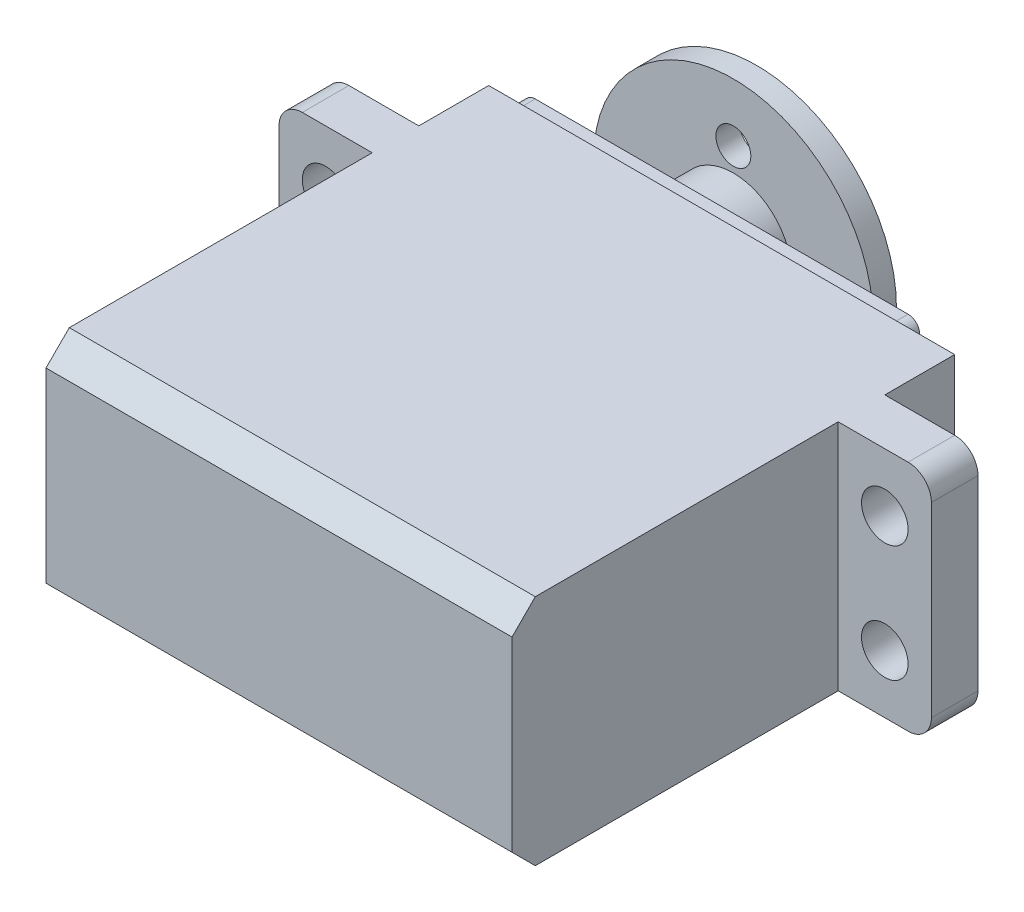
from build123d import *

# Parameters (mm, degrees)
SKETCH_1_W             = 40
SKETCH_1_H             = 40
EXTRUDE_1_DEPTH        = 20
CHAMFER_1_SIZE         = 2
CHAMFER_2_SIZE         = 2
SKETCH_2_W             = 40
SKETCH_2_H             = 20
SKETCH_2_W_2           = 34
SKETCH_2_H_2           = 18
CUT_EXTRUDE_1_DEPTH    = 2
FILLET_1_R             = 1
FILLET_2_R             = 1
FILLET_3_R             = 1
FILLET_4_R             = 1
SKETCH_3_R             = 5
EXTRUDE_2_DEPTH        = 7
SKETCH_4_R             = 12
EXTRUDE_3_DEPTH        = 2
CUT_EXTRUDE_2_REACH    = 59.315
SKETCH_5_R             = 1.5
SKETCH_6_W             = 4
SKETCH_6_H             = 20
EXTRUDE_4_DEPTH        = 8
CUT_EXTRUDE_3_REACH    = 49.875
SKETCH_7_R             = 2
FILLET_5_R             = 2
FILLET_6_R             = 2
FILLET_5_OF_MIRROR_1_R = 2
FILLET_6_OF_MIRROR_1_R = 2


with BuildPart() as part:
    # 草图1 → 凸台-拉伸1 (new body)
    with BuildSketch(Plane(origin=(0, 0, 0), x_dir=(1, 0, 0), z_dir=(0, 1, 0))):
        Rectangle(SKETCH_1_W, SKETCH_1_H)
    extrude(amount=EXTRUDE_1_DEPTH)

    # Chamfer 1
    chamfer_1_edges = [part.edges().sort_by_distance(p)[0] for p in [
        (0, 0, 20),
    ]]
    chamfer(chamfer_1_edges, length=CHAMFER_1_SIZE)

    # Chamfer 2
    chamfer_2_edges = [part.edges().sort_by_distance(p)[0] for p in [
        (0, 20, 20),
    ]]
    chamfer(chamfer_2_edges, length=CHAMFER_2_SIZE)

    # 草图2 → 切除-拉伸1 (cut)
    with BuildSketch(Plane(origin=(0, 0, -20), x_dir=(-1, 0, 0), z_dir=(0, 0, -1))):
        with Locations((0, 10)):
            Rectangle(SKETCH_2_W, SKETCH_2_H)
        with Locations((2, 10)):
            Rectangle(SKETCH_2_W_2, SKETCH_2_H_2, mode=Mode.SUBTRACT)
    extrude(amount=-CUT_EXTRUDE_1_DEPTH, mode=Mode.SUBTRACT)

    # Fillet 1
    fillet_1_edges = [part.edges().sort_by_distance(p)[0] for p in [
        (15, 1, -19),
    ]]
    fillet(fillet_1_edges, radius=FILLET_1_R)

    # Fillet 2
    fillet_2_edges = [part.edges().sort_by_distance(p)[0] for p in [
        (15, 19, -19),
    ]]
    fillet(fillet_2_edges, radius=FILLET_2_R)

    # 圆角3
    fillet_3_edges = [part.edges().sort_by_distance(p)[0] for p in [
        (-19, 1, -19),
    ]]
    fillet(fillet_3_edges, radius=FILLET_3_R)

    # 圆角4
    fillet_4_edges = [part.edges().sort_by_distance(p)[0] for p in [
        (-19, 19, -19),
    ]]
    fillet(fillet_4_edges, radius=FILLET_4_R)

    # 草图3 → 凸台-拉伸2 (add)
    with BuildSketch(Plane(origin=(0, 0, -20), x_dir=(-1, 0, 0), z_dir=(0, 0, -1))):
        with Locations((8, 10)):
            Circle(SKETCH_3_R)
    extrude(amount=EXTRUDE_2_DEPTH)

    # 草图4 → 凸台-拉伸3 (add)
    with BuildSketch(Plane(origin=(0, 0, -27), x_dir=(-1, 0, 0), z_dir=(0, 0, -1))):
        with Locations((8, 10)):
            Circle(SKETCH_4_R)
    extrude(amount=EXTRUDE_3_DEPTH)

    # 草图5 → 切除-拉伸2 (cut, up to next)
    with BuildSketch(Plane(origin=(0, 0, -29), x_dir=(-1, 0, 0), z_dir=(0, 0, -1)), mode=Mode.PRIVATE) as cut_extrude_2_sk1:
        with Locations((8, 17)):
            Circle(SKETCH_5_R)
    cut_extrude_2_tool1 = extrude(cut_extrude_2_sk1.sketch, amount=-CUT_EXTRUDE_2_REACH, mode=Mode.PRIVATE) & part.part
    # 草图5 → 切除-拉伸2 (cut, up to next)
    with BuildSketch(Plane(origin=(0, 0, -29), x_dir=(-1, 0, 0), z_dir=(0, 0, -1)), mode=Mode.PRIVATE) as cut_extrude_2_sk2:
        with Locations((15, 10)):
            Circle(SKETCH_5_R)
    cut_extrude_2_tool2 = extrude(cut_extrude_2_sk2.sketch, amount=-CUT_EXTRUDE_2_REACH, mode=Mode.PRIVATE) & part.part
    # 草图5 → 切除-拉伸2 (cut, up to next)
    with BuildSketch(Plane(origin=(0, 0, -29), x_dir=(-1, 0, 0), z_dir=(0, 0, -1)), mode=Mode.PRIVATE) as cut_extrude_2_sk3:
        with Locations((8, 3)):
            Circle(SKETCH_5_R)
    cut_extrude_2_tool3 = extrude(cut_extrude_2_sk3.sketch, amount=-CUT_EXTRUDE_2_REACH, mode=Mode.PRIVATE) & part.part
    # 草图5 → 切除-拉伸2 (cut, up to next)
    with BuildSketch(Plane(origin=(0, 0, -29), x_dir=(-1, 0, 0), z_dir=(0, 0, -1)), mode=Mode.PRIVATE) as cut_extrude_2_sk4:
        with Locations((1, 10)):
            Circle(SKETCH_5_R)
    cut_extrude_2_tool4 = extrude(cut_extrude_2_sk4.sketch, amount=-CUT_EXTRUDE_2_REACH, mode=Mode.PRIVATE) & part.part
    add(cut_extrude_2_tool1.solids().sort_by_distance((-8, 17, -29))[0], mode=Mode.SUBTRACT)
    add(cut_extrude_2_tool2.solids().sort_by_distance((-15, 10, -29))[0], mode=Mode.SUBTRACT)
    add(cut_extrude_2_tool3.solids().sort_by_distance((-8, 3, -29))[0], mode=Mode.SUBTRACT)
    add(cut_extrude_2_tool4.solids().sort_by_distance((-1, 10, -29))[0], mode=Mode.SUBTRACT)

    # 草图6 → 凸台-拉伸4 (add)
    with BuildSketch(Plane.ZY.offset(20)):
        with Locations((-10, 10)):
            Rectangle(SKETCH_6_W, SKETCH_6_H)
    extrude_4 = extrude(amount=EXTRUDE_4_DEPTH)

    # 草图7 → 切除-拉伸3 (cut, up to next)
    with BuildSketch(Plane(origin=(0, 0, -12), x_dir=(-1, 0, 0), z_dir=(0, 0, -1)), mode=Mode.PRIVATE) as cut_extrude_3_sk1:
        with Locations((24, 15)):
            Circle(SKETCH_7_R)
    cut_extrude_3_tool1 = extrude(cut_extrude_3_sk1.sketch, amount=-CUT_EXTRUDE_3_REACH, mode=Mode.PRIVATE) & part.part
    # 草图7 → 切除-拉伸3 (cut, up to next)
    with BuildSketch(Plane(origin=(0, 0, -12), x_dir=(-1, 0, 0), z_dir=(0, 0, -1)), mode=Mode.PRIVATE) as cut_extrude_3_sk2:
        with Locations((24, 5)):
            Circle(SKETCH_7_R)
    cut_extrude_3_tool2 = extrude(cut_extrude_3_sk2.sketch, amount=-CUT_EXTRUDE_3_REACH, mode=Mode.PRIVATE) & part.part
    cut_extrude_3_1 = cut_extrude_3_tool1.solids().sort_by_distance((-24, 15, -12))[0]
    add(cut_extrude_3_1, mode=Mode.SUBTRACT)
    cut_extrude_3_2 = cut_extrude_3_tool2.solids().sort_by_distance((-24, 5, -12))[0]
    add(cut_extrude_3_2, mode=Mode.SUBTRACT)
    cut_extrude_3 = cut_extrude_3_1 + cut_extrude_3_2  # 切除-拉伸3 as one shape, for the pattern or mirror that repeats it

    # 圆角5
    fillet_5_edges = [part.edges().sort_by_distance(p)[0] for p in [
        (-28, 20, -10),
    ]]
    fillet(fillet_5_edges, radius=FILLET_5_R)

    # 圆角6
    fillet_6_edges = [part.edges().sort_by_distance(p)[0] for p in [
        (-28, 0, -10),
    ]]
    fillet(fillet_6_edges, radius=FILLET_6_R)

    # 镜向1: 凸台-拉伸4, 切除-拉伸3 across plane
    add(extrude_4.mirror(Plane(origin=(0, 0, 0), x_dir=(0, 0, 1), z_dir=(1, 0, 0))))
    add(cut_extrude_3.mirror(Plane(origin=(0, 0, 0), x_dir=(0, 0, 1), z_dir=(1, 0, 0))), mode=Mode.SUBTRACT)

    # 圆角5 of 镜向1
    fillet_5_of_mirror_1_edges = [part.edges().sort_by_distance(p)[0] for p in [
        (28, 20, -10),
    ]]
    fillet(fillet_5_of_mirror_1_edges, radius=FILLET_5_OF_MIRROR_1_R)

    # 圆角6 of 镜向1
    fillet_6_of_mirror_1_edges = [part.edges().sort_by_distance(p)[0] for p in [
        (28, 0, -10),
    ]]
    fillet(fillet_6_of_mirror_1_edges, radius=FILLET_6_OF_MIRROR_1_R)


solid = part.part
